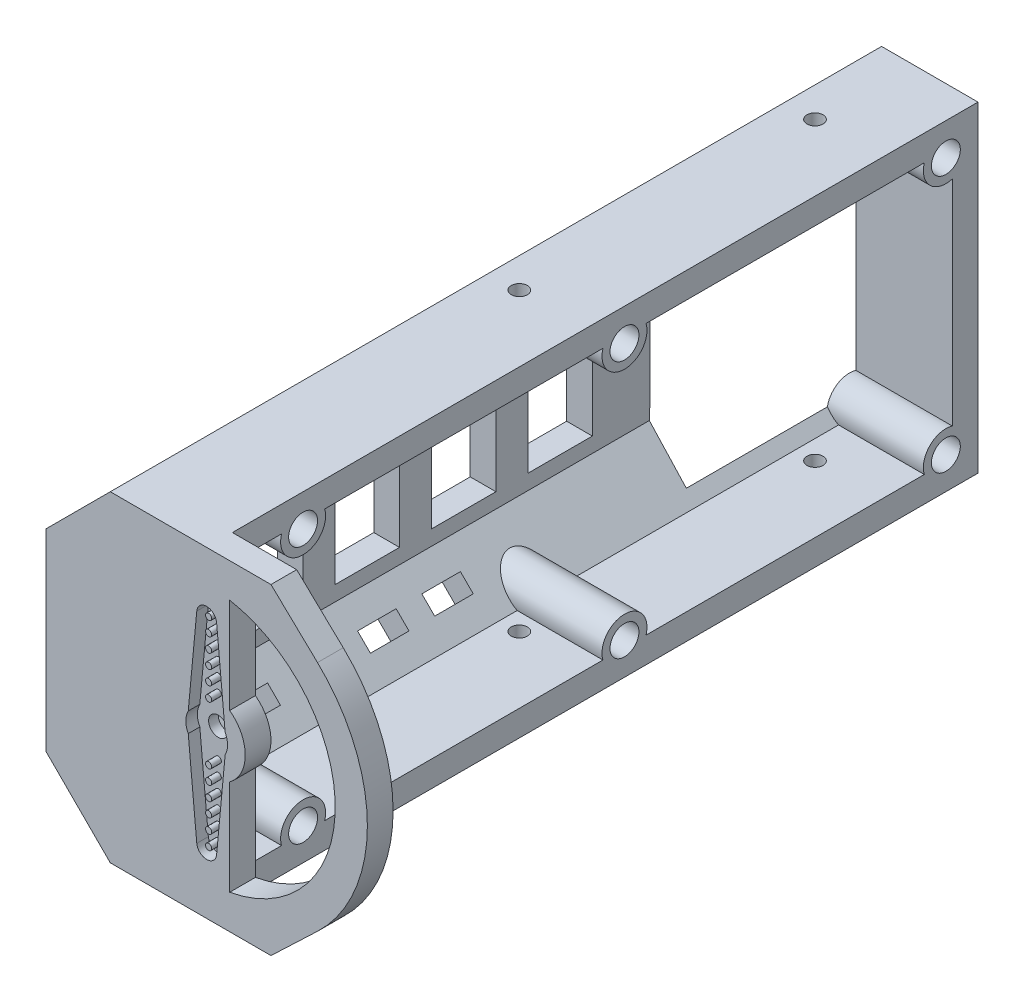
from build123d import *

# Parameters (mm, degrees)
BOSS_EXTRUDE1_DEPTH = 120
CUT_EXTRUDE1_REACH  = 134.382
SKETCH3_W           = 25.864549678
SKETCH3_H           = 116.289285906
SHELL1_START        = 4
SHELL1_DEPTH        = 112
CUT_EXTRUDE2_DEPTH  = 1.8
CUT_EXTRUDE3_REACH  = 125.374
SKETCH6_R           = 1.5
SKETCH7_R           = 2.5
CUT_EXTRUDE4_DEPTH  = 0.7
SKETCH8_R           = 0.48
BOSS_EXTRUDE2_DEPTH = 1.5
SKETCH8_3_R         = 0.48
BOSS_EXTRUDE3_DEPTH = 1.5
CUT_EXTRUDE5_REACH  = 127.1
BOSS_EXTRUDE6_REACH = 127.1
SKETCH15_R          = 3.5
CUT_EXTRUDE7_DEPTH  = 120
BOSS_EXTRUDE8_REACH = 127.1
SKETCH15_5_R        = 3.5
BOSS_EXTRUDE7_REACH = 127.1
SKETCH15_4_R        = 3.5
CUT_EXTRUDE8_DEPTH  = 120
SKETCH18_R          = 2.25
CUT_EXTRUDE9_DEPTH  = 15
CUT_EXTRUDE10_REACH = 132.924
SKETCH22_R          = 1.25
SKETCH23_W          = 10
SKETCH23_H          = 22
CUT_EXTRUDE11_DEPTH = 4
CUT_EXTRUDE13_REACH = 136.003
SKETCH25_W          = 6
SKETCH25_H          = 2.83
CUT_EXTRUDE14_REACH = 136.003
SKETCH26_W          = 6
SKETCH26_H          = 2.83
CUT_EXTRUDE15_DEPTH = 10


# Read off the part's stored shape, not the designer's step: Shell1
with BuildPart() as part:
    # Sketch2 → Boss-Extrude1 (new body)
    with BuildSketch(Plane.XY):
        with BuildLine():
            Line((0, -25), (-15, -25))
            Line((-15, -25), (-25, -15))
            Line((-25, -15), (-25, 15))
            Line((-25, 15), (-15, 25))
            Line((-15, 25), (0, 25))
            Line((0, 25), (10, 25))
            Line((10, 25), (17.24137931, 18.103448276))
            ThreePointArc((17.24137931, 18.103448276), (25, 0), (17.24137931, -18.103448276))
            Line((17.24137931, -18.103448276), (10, -25))
            Line((10, -25), (0, -25))
        make_face()
    extrude(amount=BOSS_EXTRUDE1_DEPTH)

    # Sketch3 → Cut-Extrude1 (cut, up to next)
    with BuildSketch(Plane(origin=(0, -25, 0), x_dir=(1, 0, 0), z_dir=(0, 1, 0)), mode=Mode.PRIVATE) as cut_extrude1_sk1:
        with Locations((12.932274839, -57.855357047)):
            Rectangle(SKETCH3_W, SKETCH3_H)
    cut_extrude1_tool1 = extrude(cut_extrude1_sk1.sketch, amount=CUT_EXTRUDE1_REACH, mode=Mode.PRIVATE) & part.part
    add(cut_extrude1_tool1.solids().sort_by_distance((12.932275, -25, 57.855357))[0], mode=Mode.SUBTRACT)

    # Shell1 outline → Shell1 (cut)
    with BuildSketch(Plane.XY.offset(SHELL1_START)):
        Polygon((-13.343145751, -21), (0, -21), (0, 21), (-13.343145751, 21), (-21, 13.343145751), (-21, -13.343145751), align=None)
    extrude(amount=SHELL1_DEPTH, mode=Mode.SUBTRACT)

    # Sketch5 → Cut-Extrude2 (cut)
    with BuildSketch(Plane.XY.offset(120)):
        with BuildLine():
            Line((-2.869908719, -1.525163579), (-1.543202838, -15.645))
            ThreePointArc((-1.543202838, -15.645), (0, -17.05), (1.543202838, -15.645))
            Line((1.543202838, -15.645), (2.869908719, -1.525163579))
            ThreePointArc((2.869908719, -1.525163579), (3.25, 0), (2.869908719, 1.525163579))
            Line((2.869908719, 1.525163579), (1.543202838, 15.645))
            ThreePointArc((1.543202838, 15.645), (0, 17.05), (-1.543202838, 15.645))
            Line((-1.543202838, 15.645), (-2.869908719, 1.525163579))
            ThreePointArc((-2.869908719, 1.525163579), (-3.25, 0), (-2.869908719, -1.525163579))
        make_face()
    extrude(amount=-CUT_EXTRUDE2_DEPTH, mode=Mode.SUBTRACT)

    # Sketch6 → Cut-Extrude3 (cut, up to next)
    with BuildSketch(Plane.XY.offset(118.2), mode=Mode.PRIVATE) as cut_extrude3_sk1:
        Circle(SKETCH6_R)
    cut_extrude3_tool1 = extrude(cut_extrude3_sk1.sketch, amount=-CUT_EXTRUDE3_REACH, mode=Mode.PRIVATE) & part.part
    add(cut_extrude3_tool1.solids().sort_by_distance((0, 0, 118.2))[0], mode=Mode.SUBTRACT)

    # Sketch7 → Cut-Extrude4 (cut)
    with BuildSketch(Plane(origin=(0, 0, 116), x_dir=(-1, 0, 0), z_dir=(0, 0, -1))):
        Circle(SKETCH7_R)
    extrude(amount=-CUT_EXTRUDE4_DEPTH, mode=Mode.SUBTRACT)

    # Sketch8 → Boss-Extrude2 (add)
    with BuildSketch(Plane.XY.offset(118.2)):
        with Locations((0, 13.3)):
            Circle(SKETCH8_R)
        with Locations((0, 8.9)):
            Circle(SKETCH8_R)
        with Locations((0, 15.5)):
            Circle(SKETCH8_R)
        with Locations((0, 11.1)):
            Circle(SKETCH8_R)
        with Locations((0, 6.7)):
            Circle(SKETCH8_R)
        with Locations((0, 4.5)):
            Circle(SKETCH8_R)
    extrude(amount=BOSS_EXTRUDE2_DEPTH)

    # Sketch8<3> → Boss-Extrude3 (add)
    with BuildSketch(Plane.XY.offset(118.2)):
        with Locations((0, -6.7)):
            Circle(SKETCH8_3_R)
        with Locations((0, -8.9)):
            Circle(SKETCH8_3_R)
        with Locations((0, -11.1)):
            Circle(SKETCH8_3_R)
        with Locations((0, -13.3)):
            Circle(SKETCH8_3_R)
        with Locations((0, -15.5)):
            Circle(SKETCH8_3_R)
        with Locations(Location((0, -4.5, 0), (0, 0, 180))):
            Circle(SKETCH8_3_R)
    extrude(amount=BOSS_EXTRUDE3_DEPTH)

    # Sketch9 → Cut-Extrude5 (cut, up to next)
    with BuildSketch(Plane.XY.offset(120), mode=Mode.PRIVATE) as cut_extrude5_sk1:
        with BuildLine():
            Line((3.578622529, 19.677232041), (3.578622529, 4.815958969))
            ThreePointArc((3.578622529, 4.815958969), (6, 0), (3.578622529, -4.815958969))
            Line((3.578622529, -4.815958969), (3.578622529, -19.677232041))
            ThreePointArc((3.578622529, -19.677232041), (20, 0), (3.578622529, 19.677232041))
        make_face()
    cut_extrude5_tool1 = extrude(cut_extrude5_sk1.sketch, amount=-CUT_EXTRUDE5_REACH, mode=Mode.PRIVATE) & part.part
    add(cut_extrude5_tool1.solids().sort_by_distance((10.656828, 0, 120))[0], mode=Mode.SUBTRACT)

    # Boss-Extrude6: up to this face of the body (flat: up to its plane)
    boss_extrude6_end = Plane(part.part.faces().sort_by_distance((-21, 0, 60))[0])
    # Sketch15 → Boss-Extrude6 (add, up to the picked face)
    with BuildSketch(Plane(origin=(0, 0, 0), x_dir=(0, 0, -1), z_dir=(1, 0, 0)), mode=Mode.PRIVATE) as boss_extrude6_sk1:
        with BuildLine():
            Line((-108.354101966, -21), (-101.645898034, -21))
            ThreePointArc((-101.645898034, -21), (-101.536666571, -20.505293538), (-101.5, -20))
            ThreePointArc((-101.5, -20), (-105.505293538, -16.536666571), (-108.354101966, -21))
        make_face()
    boss_extrude6_tool1 = split(extrude(boss_extrude6_sk1.sketch, amount=-BOSS_EXTRUDE6_REACH, mode=Mode.PRIVATE), bisect_by=boss_extrude6_end, keep=Keep.BOTH, mode=Mode.PRIVATE)
    # Sketch15 → Boss-Extrude6 (add, up to the picked face)
    with BuildSketch(Plane(origin=(0, 0, 0), x_dir=(0, 0, -1), z_dir=(1, 0, 0)), mode=Mode.PRIVATE) as boss_extrude6_sk2:
        with Locations((-5, 20)):
            Circle(SKETCH15_R)
    boss_extrude6_tool2 = split(extrude(boss_extrude6_sk2.sketch, amount=-BOSS_EXTRUDE6_REACH, mode=Mode.PRIVATE), bisect_by=boss_extrude6_end, keep=Keep.BOTH, mode=Mode.PRIVATE)
    # Sketch15 → Boss-Extrude6 (add, up to the picked face)
    with BuildSketch(Plane(origin=(0, 0, 0), x_dir=(0, 0, -1), z_dir=(1, 0, 0)), mode=Mode.PRIVATE) as boss_extrude6_sk3:
        with Locations((-105, 20)):
            Circle(SKETCH15_R)
    boss_extrude6_tool3 = split(extrude(boss_extrude6_sk3.sketch, amount=-BOSS_EXTRUDE6_REACH, mode=Mode.PRIVATE), bisect_by=boss_extrude6_end, keep=Keep.BOTH, mode=Mode.PRIVATE)
    add(boss_extrude6_tool1.solids().sort_by(Axis((0, -19.037867, 105), (-1, 0, 0)))[0])
    add(boss_extrude6_tool2.solids().sort_by(Axis((0, 20, 5), (-1, 0, 0)))[0])
    add(boss_extrude6_tool3.solids().sort_by(Axis((0, 20, 105), (-1, 0, 0)))[0])

    # Sketch16 → Cut-Extrude7 (cut)
    with BuildSketch(Plane(origin=(0, 0, 0), x_dir=(-1, 0, 0), z_dir=(0, 0, -1))):
        Polygon((15, 25), (25, 15), (21.747646776, 24.569697253), align=None)
    extrude(amount=-CUT_EXTRUDE7_DEPTH, mode=Mode.SUBTRACT)

    # Boss-Extrude8: up to this plane
    boss_extrude8_end = Plane(origin=(-12.171572875, 22.171572875, 120), z_dir=(0.7071067811865476, -0.7071067811865476, 0))
    # Sketch15<5> → Boss-Extrude8 (add, up to the surface)
    with BuildSketch(Plane(origin=(0, 0, 0), x_dir=(0, 0, -1), z_dir=(1, 0, 0)), mode=Mode.PRIVATE) as boss_extrude8_sk1:
        with Locations((-55, 20)):
            Circle(SKETCH15_5_R)
    boss_extrude8_tool1 = split(extrude(boss_extrude8_sk1.sketch, amount=-BOSS_EXTRUDE8_REACH, mode=Mode.PRIVATE), bisect_by=boss_extrude8_end, keep=Keep.BOTH, mode=Mode.PRIVATE)
    add(boss_extrude8_tool1.solids().sort_by_distance((0, 20, 55))[0])

    # Boss-Extrude7: up to this plane
    boss_extrude7_end = Plane(origin=(-22.171572875, -12.171572875, 120), z_dir=(0.7071067811865476, 0.7071067811865476, 0))
    # Sketch15<4> → Boss-Extrude7 (add, up to the surface)
    with BuildSketch(Plane(origin=(0, 0, 0), x_dir=(0, 0, -1), z_dir=(1, 0, 0)), mode=Mode.PRIVATE) as boss_extrude7_sk1:
        with Locations((-5, -20)):
            Circle(SKETCH15_4_R)
    boss_extrude7_tool1 = split(extrude(boss_extrude7_sk1.sketch, amount=-BOSS_EXTRUDE7_REACH, mode=Mode.PRIVATE), bisect_by=boss_extrude7_end, keep=Keep.BOTH, mode=Mode.PRIVATE)
    add(boss_extrude7_tool1.solids().sort_by_distance((0, -20, 5))[0])
    # Sketch15<4> → Boss-Extrude7 (add, up to the surface)
    with BuildSketch(Plane(origin=(0, 0, 0), x_dir=(0, 0, -1), z_dir=(1, 0, 0)), mode=Mode.PRIVATE) as boss_extrude7_sk2:
        with Locations((-55, -20)):
            Circle(SKETCH15_4_R)
    boss_extrude7_tool2 = split(extrude(boss_extrude7_sk2.sketch, amount=-BOSS_EXTRUDE7_REACH, mode=Mode.PRIVATE), bisect_by=boss_extrude7_end, keep=Keep.BOTH, mode=Mode.PRIVATE)
    add(boss_extrude7_tool2.solids().sort_by_distance((0, -20, 55))[0])

    # Sketch17 → Cut-Extrude8 (cut)
    with BuildSketch(Plane(origin=(0, 0, 0), x_dir=(-1, 0, 0), z_dir=(0, 0, -1))):
        Polygon((15, -25), (25, -15), (23.622900626, -22.657003141), align=None)
    extrude(amount=-CUT_EXTRUDE8_DEPTH, mode=Mode.SUBTRACT)

    # Sketch18 → Cut-Extrude9 (cut)
    with BuildSketch(Plane(origin=(0, 0, 0), x_dir=(0, 0, -1), z_dir=(1, 0, 0))):
        with Locations((-5, 20)):
            Circle(SKETCH18_R)
        with Locations(Location((-5, -20, 0), (0, 0, 180))):
            Circle(SKETCH18_R)
        with Locations(Location((-105, 20, 0), (0, 0, 180))):
            Circle(SKETCH18_R)
        with Locations((-105, -20)):
            Circle(SKETCH18_R)
        with Locations((-55, -20)):
            Circle(SKETCH18_R)
        with Locations(Location((-55, 20, 0), (0, 0, 180))):
            Circle(SKETCH18_R)
    extrude(amount=-CUT_EXTRUDE9_DEPTH, mode=Mode.SUBTRACT)

    # Sketch22 → Cut-Extrude10 (cut, up to next)
    with BuildSketch(Plane(origin=(0, -21, 0), x_dir=(1, 0, 0), z_dir=(0, 1, 0)), mode=Mode.PRIVATE) as cut_extrude10_sk1:
        with Locations(Location((-10.343145751, -15.015564437, 0), (0, 0, 270))):
            Circle(SKETCH22_R)
    cut_extrude10_tool1 = extrude(cut_extrude10_sk1.sketch, amount=-CUT_EXTRUDE10_REACH, mode=Mode.PRIVATE) & part.part
    # Sketch22 → Cut-Extrude10 (cut, up to next)
    with BuildSketch(Plane(origin=(0, -21, 0), x_dir=(1, 0, 0), z_dir=(0, 1, 0)), mode=Mode.PRIVATE) as cut_extrude10_sk2:
        with Locations(Location((-10.343145751, -61.015564437, 0), (0, 0, 270))):
            Circle(SKETCH22_R)
    cut_extrude10_tool2 = extrude(cut_extrude10_sk2.sketch, amount=-CUT_EXTRUDE10_REACH, mode=Mode.PRIVATE) & part.part
    cut_extrude10_1 = cut_extrude10_tool1.solids().sort_by_distance((-10.343146, -21, 15.015564))[0]
    add(cut_extrude10_1, mode=Mode.SUBTRACT)
    cut_extrude10_2 = cut_extrude10_tool2.solids().sort_by_distance((-10.343146, -21, 61.015564))[0]
    add(cut_extrude10_2, mode=Mode.SUBTRACT)
    cut_extrude10 = cut_extrude10_1 + cut_extrude10_2  # Cut-Extrude10 as one shape, for the pattern or mirror that repeats it

    # Mirror1: Cut-Extrude10 across plane
    add(cut_extrude10.mirror(Plane(origin=(0, 0, 0), x_dir=(0, 0, 1), z_dir=(0, -1, 0))), mode=Mode.SUBTRACT)

    # Sketch23 → Cut-Extrude11 (cut)
    with BuildSketch(Plane(origin=(-21, 0, 0), x_dir=(0, 0, -1), z_dir=(1, 0, 0))):
        with Locations((-44, 0)):
            Rectangle(SKETCH23_W, SKETCH23_H)
        with Locations((-59, 0)):
            Rectangle(SKETCH23_W, SKETCH23_H)
        with Locations((-74, 0)):
            Rectangle(SKETCH23_W, SKETCH23_H)
        with Locations((-89, 0)):
            Rectangle(SKETCH23_W, SKETCH23_H)
        with Locations((-104, 0)):
            Rectangle(SKETCH23_W, SKETCH23_H)
    extrude(amount=-CUT_EXTRUDE11_DEPTH, mode=Mode.SUBTRACT)

    # Sketch25 → Cut-Extrude13 (cut, up to next)
    with BuildSketch(Plane(origin=(-17.171572875, 17.171572875, 0), x_dir=(0, 0, -1), z_dir=(0.7071067811865477, -0.7071067811865475, 0)), mode=Mode.PRIVATE) as cut_extrude13_sk1:
        with Locations((-15, -0.000786438)):
            Rectangle(SKETCH25_W, SKETCH25_H)
    cut_extrude13_tool1 = extrude(cut_extrude13_sk1.sketch, amount=-CUT_EXTRUDE13_REACH, mode=Mode.PRIVATE) & part.part
    # Sketch25 → Cut-Extrude13 (cut, up to next)
    with BuildSketch(Plane(origin=(-17.171572875, 17.171572875, 0), x_dir=(0, 0, -1), z_dir=(0.7071067811865477, -0.7071067811865475, 0)), mode=Mode.PRIVATE) as cut_extrude13_sk2:
        with Locations((-25, -0.000786438)):
            Rectangle(SKETCH25_W, SKETCH25_H)
    cut_extrude13_tool2 = extrude(cut_extrude13_sk2.sketch, amount=-CUT_EXTRUDE13_REACH, mode=Mode.PRIVATE) & part.part
    # Sketch25 → Cut-Extrude13 (cut, up to next)
    with BuildSketch(Plane(origin=(-17.171572875, 17.171572875, 0), x_dir=(0, 0, -1), z_dir=(0.7071067811865477, -0.7071067811865475, 0)), mode=Mode.PRIVATE) as cut_extrude13_sk3:
        with Locations((-35, -0.000786438)):
            Rectangle(SKETCH25_W, SKETCH25_H)
    cut_extrude13_tool3 = extrude(cut_extrude13_sk3.sketch, amount=-CUT_EXTRUDE13_REACH, mode=Mode.PRIVATE) & part.part
    # Sketch25 → Cut-Extrude13 (cut, up to next)
    with BuildSketch(Plane(origin=(-17.171572875, 17.171572875, 0), x_dir=(0, 0, -1), z_dir=(0.7071067811865477, -0.7071067811865475, 0)), mode=Mode.PRIVATE) as cut_extrude13_sk4:
        with Locations((-45, -0.000786438)):
            Rectangle(SKETCH25_W, SKETCH25_H)
    cut_extrude13_tool4 = extrude(cut_extrude13_sk4.sketch, amount=-CUT_EXTRUDE13_REACH, mode=Mode.PRIVATE) & part.part
    # Sketch25 → Cut-Extrude13 (cut, up to next)
    with BuildSketch(Plane(origin=(-17.171572875, 17.171572875, 0), x_dir=(0, 0, -1), z_dir=(0.7071067811865477, -0.7071067811865475, 0)), mode=Mode.PRIVATE) as cut_extrude13_sk5:
        with Locations((-65, -0.000786438)):
            Rectangle(SKETCH25_W, SKETCH25_H)
    cut_extrude13_tool5 = extrude(cut_extrude13_sk5.sketch, amount=-CUT_EXTRUDE13_REACH, mode=Mode.PRIVATE) & part.part
    # Sketch25 → Cut-Extrude13 (cut, up to next)
    with BuildSketch(Plane(origin=(-17.171572875, 17.171572875, 0), x_dir=(0, 0, -1), z_dir=(0.7071067811865477, -0.7071067811865475, 0)), mode=Mode.PRIVATE) as cut_extrude13_sk6:
        with Locations((-95, -0.000786438)):
            Rectangle(SKETCH25_W, SKETCH25_H)
    cut_extrude13_tool6 = extrude(cut_extrude13_sk6.sketch, amount=-CUT_EXTRUDE13_REACH, mode=Mode.PRIVATE) & part.part
    # Sketch25 → Cut-Extrude13 (cut, up to next)
    with BuildSketch(Plane(origin=(-17.171572875, 17.171572875, 0), x_dir=(0, 0, -1), z_dir=(0.7071067811865477, -0.7071067811865475, 0)), mode=Mode.PRIVATE) as cut_extrude13_sk7:
        with Locations((-85, -0.000786438)):
            Rectangle(SKETCH25_W, SKETCH25_H)
    cut_extrude13_tool7 = extrude(cut_extrude13_sk7.sketch, amount=-CUT_EXTRUDE13_REACH, mode=Mode.PRIVATE) & part.part
    # Sketch25 → Cut-Extrude13 (cut, up to next)
    with BuildSketch(Plane(origin=(-17.171572875, 17.171572875, 0), x_dir=(0, 0, -1), z_dir=(0.7071067811865477, -0.7071067811865475, 0)), mode=Mode.PRIVATE) as cut_extrude13_sk8:
        with Locations((-75, -0.000786438)):
            Rectangle(SKETCH25_W, SKETCH25_H)
    cut_extrude13_tool8 = extrude(cut_extrude13_sk8.sketch, amount=-CUT_EXTRUDE13_REACH, mode=Mode.PRIVATE) & part.part
    add(cut_extrude13_tool1.solids().sort_by_distance((-17.172129, 17.171017, 15))[0], mode=Mode.SUBTRACT)
    add(cut_extrude13_tool2.solids().sort_by_distance((-17.172129, 17.171017, 25))[0], mode=Mode.SUBTRACT)
    add(cut_extrude13_tool3.solids().sort_by_distance((-17.172129, 17.171017, 35))[0], mode=Mode.SUBTRACT)
    add(cut_extrude13_tool4.solids().sort_by_distance((-17.172129, 17.171017, 45))[0], mode=Mode.SUBTRACT)
    add(cut_extrude13_tool5.solids().sort_by_distance((-17.172129, 17.171017, 65))[0], mode=Mode.SUBTRACT)
    add(cut_extrude13_tool6.solids().sort_by_distance((-17.172129, 17.171017, 95))[0], mode=Mode.SUBTRACT)
    add(cut_extrude13_tool7.solids().sort_by_distance((-17.172129, 17.171017, 85))[0], mode=Mode.SUBTRACT)
    add(cut_extrude13_tool8.solids().sort_by_distance((-17.172129, 17.171017, 75))[0], mode=Mode.SUBTRACT)

    # Sketch26 → Cut-Extrude14 (cut, up to next)
    with BuildSketch(Plane(origin=(-17.171572875, -17.171572875, 0), x_dir=(0, 0, -1), z_dir=(0.7071067811865477, 0.7071067811865475, 0)), mode=Mode.PRIVATE) as cut_extrude14_sk1:
        with Locations((-75.354101966, 0.000786438)):
            Rectangle(SKETCH26_W, SKETCH26_H)
    cut_extrude14_tool1 = extrude(cut_extrude14_sk1.sketch, amount=-CUT_EXTRUDE14_REACH, mode=Mode.PRIVATE) & part.part
    # Sketch26 → Cut-Extrude14 (cut, up to next)
    with BuildSketch(Plane(origin=(-17.171572875, -17.171572875, 0), x_dir=(0, 0, -1), z_dir=(0.7071067811865477, 0.7071067811865475, 0)), mode=Mode.PRIVATE) as cut_extrude14_sk2:
        with Locations((-65.354101966, 0.000786438)):
            Rectangle(SKETCH26_W, SKETCH26_H)
    cut_extrude14_tool2 = extrude(cut_extrude14_sk2.sketch, amount=-CUT_EXTRUDE14_REACH, mode=Mode.PRIVATE) & part.part
    # Sketch26 → Cut-Extrude14 (cut, up to next)
    with BuildSketch(Plane(origin=(-17.171572875, -17.171572875, 0), x_dir=(0, 0, -1), z_dir=(0.7071067811865477, 0.7071067811865475, 0)), mode=Mode.PRIVATE) as cut_extrude14_sk3:
        with Locations((-85.354101966, 0.000786438)):
            Rectangle(SKETCH26_W, SKETCH26_H)
    cut_extrude14_tool3 = extrude(cut_extrude14_sk3.sketch, amount=-CUT_EXTRUDE14_REACH, mode=Mode.PRIVATE) & part.part
    # Sketch26 → Cut-Extrude14 (cut, up to next)
    with BuildSketch(Plane(origin=(-17.171572875, -17.171572875, 0), x_dir=(0, 0, -1), z_dir=(0.7071067811865477, 0.7071067811865475, 0)), mode=Mode.PRIVATE) as cut_extrude14_sk4:
        with Locations((-95.354101966, 0.000786438)):
            Rectangle(SKETCH26_W, SKETCH26_H)
    cut_extrude14_tool4 = extrude(cut_extrude14_sk4.sketch, amount=-CUT_EXTRUDE14_REACH, mode=Mode.PRIVATE) & part.part
    add(cut_extrude14_tool1.solids().sort_by_distance((-17.172129, -17.171017, 75.354102))[0], mode=Mode.SUBTRACT)
    add(cut_extrude14_tool2.solids().sort_by_distance((-17.172129, -17.171017, 65.354102))[0], mode=Mode.SUBTRACT)
    add(cut_extrude14_tool3.solids().sort_by_distance((-17.172129, -17.171017, 85.354102))[0], mode=Mode.SUBTRACT)
    add(cut_extrude14_tool4.solids().sort_by_distance((-17.172129, -17.171017, 95.354102))[0], mode=Mode.SUBTRACT)

    # Sketch27 → Cut-Extrude15 (cut)
    with BuildSketch(Plane.ZY.offset(25)):
        Polygon((0, 25), (30, 25.37339009), (30, 23.862428396), (30, 10), (30, -10), (30.637277606, -25.82863339), (0, -25.82863339), (0, -25), align=None)
    extrude(amount=-CUT_EXTRUDE15_DEPTH, mode=Mode.SUBTRACT)


solid = part.part
